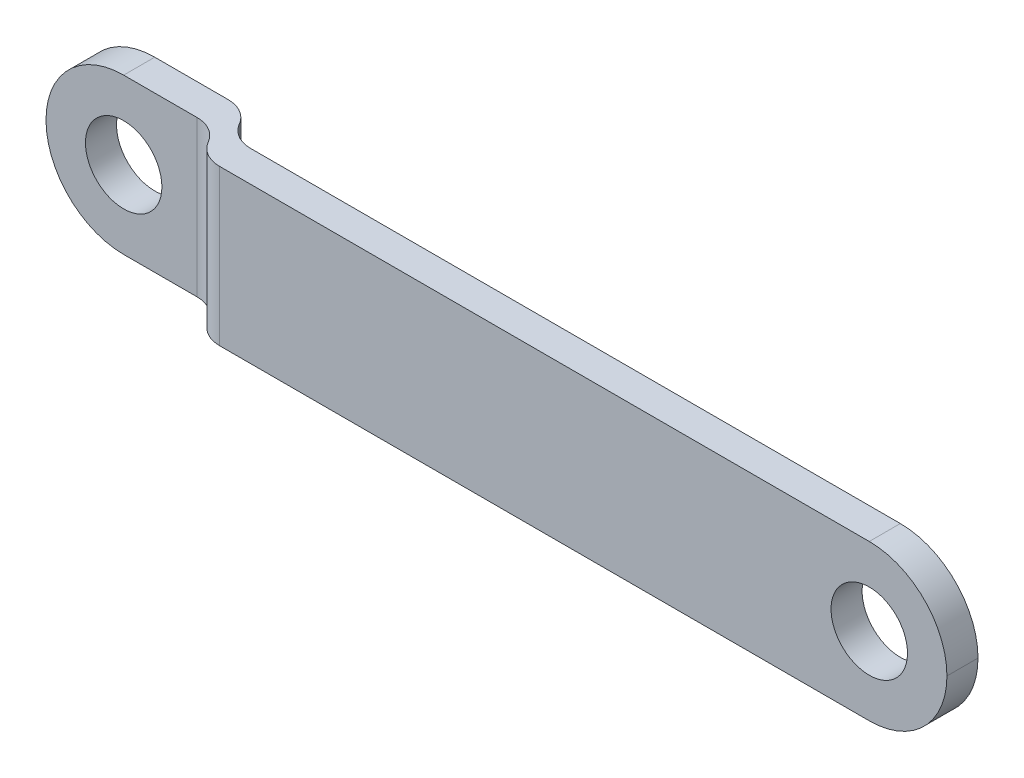
from build123d import *

# Parameters (mm, degrees)
SKETCH1_W                    = 152.4
SKETCH1_H                    = 25.4
BOSS_EXTRUDE1_DEPTH          = 5.08
F_12_5_12_5_DIAMETER_HOLE1_D = 12.5
FILLET3_R                    = 12.7
CUT_EXTRUDE1_START           = -76.2
CUT_EXTRUDE1_OUTLINE_W       = 25.4
CUT_EXTRUDE1_OUTLINE_H       = 2.54
CUT_EXTRUDE1_DEPTH           = 28.395084053
BOSS_EXTRUDE2_START          = -7.62
SKETCH10_R                   = 6.25
BOSS_EXTRUDE2_DEPTH          = 7.62
FILLET12_R                   = 5.08
CUT_EXTRUDE2_START           = -2.54
SKETCH12_R                   = 6.25
CUT_EXTRUDE2_DEPTH           = 2.54
FILLET14_R                   = 5.08
FILLET13_R                   = 5.08
FILLET15_R                   = 5.08


# Read off the part's stored shape, not the designer's step: Cut-Extrude1
with BuildPart() as part:
    # Sketch1 → Boss-Extrude1 (new body)
    with BuildSketch(Plane.XY):
        Rectangle(SKETCH1_W, SKETCH1_H)
    extrude(amount=BOSS_EXTRUDE1_DEPTH)

    # Ø12.5 (12.5) Diameter Hole1 (through all)
    with Locations(Plane.XY.offset(5.08)):
        with Locations((-63.5, 0), (63.5, 0)):
            Hole(F_12_5_12_5_DIAMETER_HOLE1_D / 2)

    # Fillet3
    fillet3_edges = [part.edges().sort_by_distance(p)[0] for p in [
        (-76.2, 12.7, 2.54),
        (-76.2, -12.7, 2.54),
        (76.2, -12.7, 2.54),
        (76.2, 12.7, 2.54),
    ]]
    fillet(fillet3_edges, radius=FILLET3_R - 0.0001)  # a hair under: the kernel refuses the full size

    # Cut-Extrude1 outline → Cut-Extrude1 (cut)
    with BuildSketch(Plane.YZ.offset(CUT_EXTRUDE1_START)):
        with Locations((0, 3.81)):
            Rectangle(CUT_EXTRUDE1_OUTLINE_W, CUT_EXTRUDE1_OUTLINE_H)
    extrude(amount=CUT_EXTRUDE1_DEPTH, mode=Mode.SUBTRACT)

    # Sketch10 → Boss-Extrude2 (add)
    with BuildSketch(Plane.XY.offset(2.54).offset(BOSS_EXTRUDE2_START)):
        with BuildLine():
            Line((-47.804915947, 12.7), (-63.5, 12.7))
            ThreePointArc((-63.5, 12.7), (-72.480256121, 8.980256121), (-76.2, 0))
            ThreePointArc((-76.2, 0), (-72.480256121, -8.980256121), (-63.5, -12.7))
            Line((-63.5, -12.7), (-47.804915947, -12.7))
            Line((-47.804915947, -12.7), (-47.804915947, 12.7))
        make_face()
        with Locations((-63.5, 0)):
            Circle(SKETCH10_R, mode=Mode.SUBTRACT)
    extrude(amount=BOSS_EXTRUDE2_DEPTH)

    # Fillet12
    fillet12_edges = [part.edges().sort_by_distance(p)[0] for p in [
        (-47.804915947, 0, 0),
    ]]
    fillet(fillet12_edges, radius=FILLET12_R - 0.0001)  # a hair under: the kernel refuses the full size

    # Sketch12 → Cut-Extrude2 (cut)
    with BuildSketch(Plane.XY.offset(2.54).offset(CUT_EXTRUDE2_START)):
        with BuildLine():
            Line((-63.5, -12.7), (-47.804915947, -12.7))
            Line((-47.804915947, -12.7), (-47.804915947, 12.7))
            Line((-47.804915947, 12.7), (-63.5, 12.7))
            ThreePointArc((-63.5, 12.7), (-76.2, 0), (-63.5, -12.7))
        make_face()
        with Locations((-63.5, 0)):
            Circle(SKETCH12_R, mode=Mode.SUBTRACT)
    extrude(amount=CUT_EXTRUDE2_DEPTH, mode=Mode.SUBTRACT)


with BuildPart() as cut_extrude2_kept_piece:
    # of the separate pieces the step leaves, the one the design keeps (cut_extrude2_pieces_kept)
    add(part.part.solids().sort_by_distance((-42.725015947, -12.7, 0))[0])

    # Fillet14
    fillet14_edges = [cut_extrude2_kept_piece.edges().sort_by_distance(p)[0] for p in [
        (-47.804915947, 0, 5.08),
    ]]
    fillet(fillet14_edges, radius=FILLET14_R - 0.0001)  # a hair under: the kernel refuses the full size

    # Fillet13
    fillet13_edges = [cut_extrude2_kept_piece.edges().sort_by_distance(p)[0] for p in [
        (-47.804915947, 0, -5.08),
    ]]
    fillet(fillet13_edges, radius=FILLET13_R)

    # Fillet15
    fillet15_edges = [cut_extrude2_kept_piece.edges().sort_by_distance(p)[0] for p in [
        (-47.804915947, 0, 0),
    ]]
    fillet(fillet15_edges, radius=FILLET15_R)


solid = cut_extrude2_kept_piece.part
